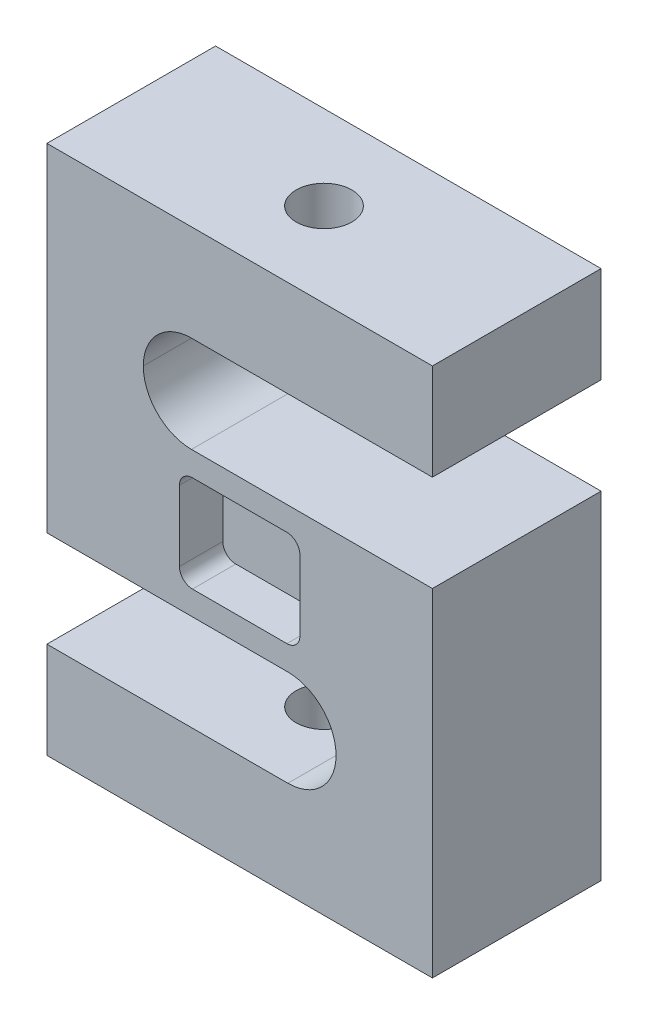
from build123d import *

# Parameters (mm, degrees)
BOSS_EXTRUDE1_DEPTH         = 22.225
FILLET1_R                   = 12.7
F_5_8_18_TAPPED_HOLE1_D     = 14.68374
F_5_8_18_TAPPED_HOLE1_DEPTH = 25.4
F_5_8_18_TAPPED_HOLE2_D     = 14.68374
F_5_8_18_TAPPED_HOLE2_DEPTH = 25.4
SKETCH8_W                   = 31.75
SKETCH8_H                   = 25.4
CUT_EXTRUDE1_DEPTH          = 11.43
FILLET2_R                   = 3.429
FILLET2_OF_MIRROR1_R        = 3.429


with BuildPart() as part:
    # Sketch1 → Boss-Extrude1 (new, symmetric)
    with BuildSketch(Plane.XY):
        Polygon((76.2, 0), (0, 0), (0, 25.4), (76.2, 25.4), (76.2, 50.8), (-25.4, 50.8), (-25.4, -38.1), (50.8, -38.1), (50.8, -63.5), (-25.4, -63.5), (-25.4, -88.9), (76.2, -88.9), align=None)
    extrude(amount=BOSS_EXTRUDE1_DEPTH, both=True)

    # Fillet1
    fillet1_edges = [part.edges().sort_by_distance(p)[0] for p in [
        (50.8, -63.5, 0),
        (50.8, -38.1, 0),
        (0, 25.4, 0),
        (0, 0, 0),
    ]]
    fillet(fillet1_edges, radius=FILLET1_R - 0.0001)  # a hair under: the kernel refuses the full size

    # 5/8-18 Tapped Hole1
    with Locations(Plane.XZ.offset(88.9)):
        with Locations((25.4, 0)):
            Hole(F_5_8_18_TAPPED_HOLE1_D / 2, depth=F_5_8_18_TAPPED_HOLE1_DEPTH)

    # 5/8-18 Tapped Hole2
    with Locations(Plane(origin=(0, 50.8, 0), x_dir=(-1, 0, 0), z_dir=(0, 1, 0))):
        with Locations((-25.4, 0)):
            Hole(F_5_8_18_TAPPED_HOLE2_D / 2, depth=F_5_8_18_TAPPED_HOLE2_DEPTH)

    # Sketch8 → Cut-Extrude1 (cut)
    with BuildSketch(Plane.XY.offset(22.225)):
        with Locations((25.4, -19.05)):
            Rectangle(SKETCH8_W, SKETCH8_H)
    cut_extrude1 = extrude(amount=-CUT_EXTRUDE1_DEPTH, mode=Mode.SUBTRACT)

    # Fillet2
    fillet2_edges = [part.edges().sort_by_distance(p)[0] for p in [
        (41.275, -6.35, 16.51),
        (41.275, -31.75, 16.51),
        (9.525, -31.75, 16.51),
        (9.525, -6.35, 16.51),
    ]]
    fillet(fillet2_edges, radius=FILLET2_R)

    # Mirror1: Cut-Extrude1 across plane
    add(cut_extrude1.mirror(Plane.XY), mode=Mode.SUBTRACT)

    # Fillet2 of Mirror1
    fillet2_of_mirror1_edges = [part.edges().sort_by_distance(p)[0] for p in [
        (41.275, -6.35, -16.51),
        (41.275, -31.75, -16.51),
        (9.525, -31.75, -16.51),
        (9.525, -6.35, -16.51),
    ]]
    fillet(fillet2_of_mirror1_edges, radius=FILLET2_OF_MIRROR1_R)


solid = part.part
